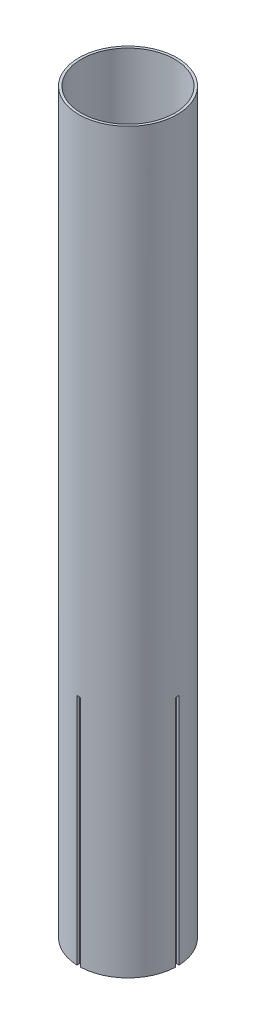
from build123d import *

# Parameters (mm, degrees)
SKETCH1_R           = 40
SKETCH1_R_2         = 38
BOSS_EXTRUDE1_DEPTH = 600
SKETCH2_W           = 3
SKETCH2_H           = 190
CUT_EXTRUDE1_DEPTH  = 603.660766933
CIRPATTERN1_COUNT   = 4


with BuildPart() as part:
    # Sketch1 → Boss-Extrude1 (new body)
    with BuildSketch(Plane(origin=(0, 0, 0), x_dir=(1, 0, 0), z_dir=(0, 1, 0))):
        Circle(SKETCH1_R)
        Circle(SKETCH1_R_2, mode=Mode.SUBTRACT)
    extrude(amount=BOSS_EXTRUDE1_DEPTH)

    # Sketch2 → Cut-Extrude1 (cut, through all)
    with BuildSketch(Plane(origin=(0, 0, 0), x_dir=(0, 0, -1), z_dir=(1, 0, 0))):
        with Locations((0, 95)):
            Rectangle(SKETCH2_W, SKETCH2_H)
    cut_extrude1 = extrude(amount=-CUT_EXTRUDE1_DEPTH, mode=Mode.SUBTRACT)

    # CirPattern1: Cut-Extrude1 ×4 about axis
    cirpattern1_axis = Axis((0, 600, 0), (0, -1, 0))
    for i in range(1, CIRPATTERN1_COUNT):
        add(cut_extrude1.rotate(cirpattern1_axis, i * 360 / CIRPATTERN1_COUNT), mode=Mode.SUBTRACT)


solid = part.part
